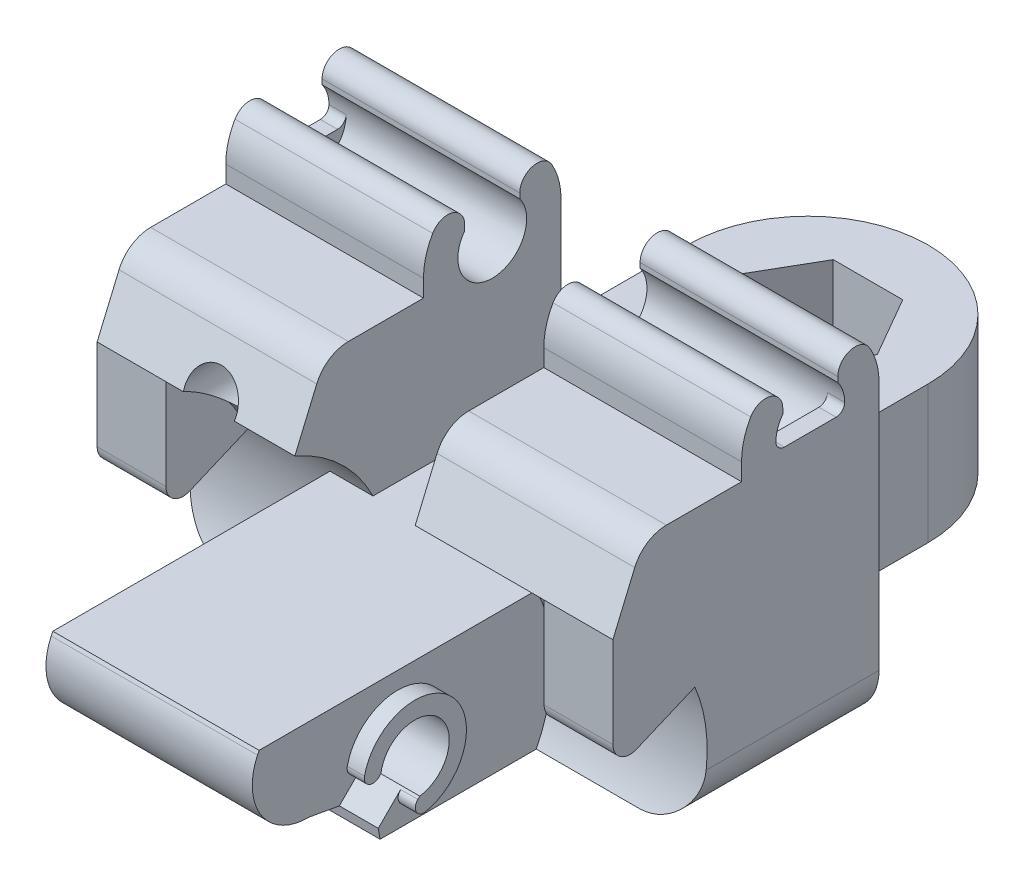
from build123d import *
from build123d.topology import SkipClean

# Parameters (mm, degrees)
BOSS_EXTRUDE1_DEPTH      = 6
BOSS_EXTRUDE2_DEPTH      = 7
SKETCH6_R                = 7
BOSS_EXTRUDE3_DEPTH      = 18
BOSS_EXTRUDE4_DEPTH      = 8
BOSS_EXTRUDE4_DEPTH_BACK = 8
SKETCH7_R                = 4.5
CUT_EXTRUDE2_DEPTH       = 5
CUT_EXTRUDE4_START       = -5
CUT_EXTRUDE4_DEPTH       = 5
BOSS_EXTRUDE6_DEPTH      = 1
FILLET3_R                = 0.5
FILLET3_OF_MIRROR1_R     = 0.5
BOSS_EXTRUDE5_DEPTH      = 15
SKETCH20_W               = 7
SKETCH20_H               = 38
CUT_EXTRUDE7_DEPTH       = 42.913087917
FILLET1_START            = -6
FILLET1_DEPTH            = 12
FILLET2_R                = 1
CUT_EXTRUDE8_DEPTH       = 42.560578801
BOSS_EXTRUDE7_DEPTH      = 1
FILLET4_R                = 0.5
FILLET4_OF_MIRROR2_R     = 0.5
FILLET5_R                = 3
FILLET7_R                = 2
CUT_SWEEP1_PROFILE_R     = 1.5
BOSS_EXTRUDE8_DEPTH      = 4
FILLET8_R                = 1
FILLET8_OF_MIRROR3_R     = 1


with BuildPart() as part:
    # Sketch3 → Boss-Extrude1 (new, symmetric)
    with BuildSketch(Plane(origin=(0, 0, 0), x_dir=(0, 0, -1), z_dir=(1, 0, 0))):
        with BuildLine():
            ThreePointArc((2, 0), (1.51090791, -1.310403483), (0.282842712, -1.979898987))
            Line((0.282842712, -1.979898987), (-1.13137085, -3.39411255))
            Line((-1.13137085, -3.39411255), (-0.81880413, -5.166766505))
            Line((-0.81880413, -5.166766505), (-3.807139593, -8.155101968))
            ThreePointArc((-3.807139593, -8.155101968), (4.834032667, -7.591582718), (9, 0))
            ThreePointArc((9, 0), (-1.949882341, 8.7862369), (-8.155101968, -3.807139593))
            Line((-8.155101968, -3.807139593), (-5.166766505, -0.81880413))
            Line((-5.166766505, -0.81880413), (-3.39411255, -1.13137085))
            Line((-3.39411255, -1.13137085), (-1.979898987, 0.282842712))
            ThreePointArc((-1.979898987, 0.282842712), (0.14177804, 1.994968418), (2, 0))
        make_face()
    extrude(amount=BOSS_EXTRUDE1_DEPTH, both=True)

    # Sketch5 → Boss-Extrude2 (add, symmetric)
    with BuildSketch(Plane(origin=(0, 0, 0), x_dir=(0, 0, -1), z_dir=(1, 0, 0))):
        with BuildLine():
            Line((0, 9), (29.855960009, 9))
            Line((29.855960009, 9), (29.855960009, -9))
            Line((29.855960009, -9), (0, -9))
            ThreePointArc((0, -9), (9, 0), (0, 9))
        make_face()
    extrude(amount=BOSS_EXTRUDE2_DEPTH, both=True)

    # Sketch6 → Boss-Extrude3 (add)
    with BuildSketch(Plane(origin=(0, 9, 0), x_dir=(1, 0, 0), z_dir=(0, 1, 0))):
        with Locations((0, 29.855960009)):
            Circle(SKETCH6_R)
    extrude(amount=-BOSS_EXTRUDE3_DEPTH)

    # Sketch7 → Boss-Extrude4 (add, two sides: drawn at the far end of the back side and taken through both)
    with BuildSketch(Plane(origin=(0, 0, 0), x_dir=(1, 0, 0), z_dir=(0, 1, 0)).offset(-BOSS_EXTRUDE4_DEPTH_BACK)):
        with Locations((0, 29.855960009)):
            Circle(SKETCH7_R)
    extrude(amount=BOSS_EXTRUDE4_DEPTH + BOSS_EXTRUDE4_DEPTH_BACK)

    # Sketch8 → Cut-Extrude2 (cut)
    with BuildSketch(Plane(origin=(0, 9, 0), x_dir=(1, 0, 0), z_dir=(0, 1, 0))):
        with BuildLine():
            Line((6, -9), (6, 0))
            Line((6, 0), (7, 0))
            Line((7, 0), (7, 29.855960009))
            ThreePointArc((7, 29.855960009), (0, 36.855960009), (-7, 29.855960009))
            Line((-7, 29.855960009), (-7, 0))
            Line((-7, 0), (-6, 0))
            Line((-6, 0), (-6, -9))
            Line((-6, -9), (6, -9))
        make_face()
    extrude(amount=-CUT_EXTRUDE2_DEPTH, mode=Mode.SUBTRACT)

    # Sketch9 → Cut-Extrude4 (cut)
    with BuildSketch(Plane.XZ.offset(9).offset(CUT_EXTRUDE4_START)):
        with BuildLine():
            Line((6, 0), (6, 9))
            Line((6, 9), (-6, 9))
            Line((-6, 9), (-6, 0))
            Line((-6, 0), (-7, 0))
            Line((-7, 0), (-7, -29.855960009))
            ThreePointArc((-7, -29.855960009), (0, -36.855960009), (7, -29.855960009))
            Line((7, -29.855960009), (7, 0))
            Line((7, 0), (6, 0))
        make_face()
    extrude(amount=CUT_EXTRUDE4_DEPTH, mode=Mode.SUBTRACT)

    # Sketch24 → Boss-Extrude6 (add)
    with SkipClean():  # the faces are left unmerged after this step: merging them gives an invalid solid
        with BuildSketch(Plane.ZY.offset(6)):
            with BuildLine():
                ThreePointArc((-0.282842712, -1.979898987), (-1.414213562, 1.414213562), (1.979898987, 0.282842712))
                Line((1.979898987, 0.282842712), (2.925806694, -0.663064995))
                ThreePointArc((2.925806694, -0.663064995), (2.981393976, -0.333601496), (3, 0))
                ThreePointArc((3, 0), (-2.344055778, 1.872272018), (0.663064995, -2.925806694))
                Line((0.663064995, -2.925806694), (-0.282842712, -1.979898987))
            make_face()
        boss_extrude6 = extrude(amount=BOSS_EXTRUDE6_DEPTH)

    # Fillet3
    # the kernel refuses this fillet: 0.5 mm, written as the material it takes off along each edge
    with BuildSketch(Plane(origin=(-6, -0.663064995, 2.925806694), x_dir=(0, 0.9999849386062066, 0.005488402385122609), z_dir=(-1, 0, 0))) as fillet3_piece_1:
        with BuildLine():
            CenterArc((1.186161173, 0.488233633), FILLET3_R, 135.314463872, 147.140119621)
            Line((0.830672664, 0.839841255), (0, 0))
            ThreePointArc((0, 0), (0.646997003, -0.070598205), (1.293994007, 0))
        make_face()
    extrude(amount=4.234985017, mode=Mode.SUBTRACT)
    with BuildSketch(Plane(origin=(-6, -2.925806694, 0.663064995), x_dir=(0, -0.005488402385198552, -0.9999849386062063), z_dir=(-1, 0, 0))) as fillet3_piece_2:
        with BuildLine():
            CenterArc((1.186161173, -0.488233633), FILLET3_R, 77.545416507, 147.140119621)
            Line((0.830672664, -0.839841255), (0, 0))
            ThreePointArc((0, 0), (0.646997003, 0.070598205), (1.293994007, 0))
        make_face()
    extrude(amount=4.234985017, mode=Mode.SUBTRACT)

    # Mirror1: Boss-Extrude6 across plane
    add(boss_extrude6.mirror(Plane(origin=(0, 0, 0), x_dir=(0, 0, 1), z_dir=(1, 0, 0))))

    # Fillet3 of Mirror1
    # the kernel refuses this fillet: 0.5 mm, written as the material it takes off along each edge
    with BuildSketch(Plane(origin=(6, -0.663064995, 2.925806694), x_dir=(0, 0.7071067811865444, -0.7071067811865507), z_dir=(1, 0, 0))) as fillet3_of_mirror1_piece_1:
        with BuildLine():
            CenterArc((1.181249511, 0.5), FILLET3_OF_MIRROR1_R, 122.859880379, 147.140119621)
            ThreePointArc((0.909956312, 0.92), (0.404784455, 0.509645734), (0, 0))
            Line((0, 0), (1.181249511, 0))
        make_face()
    extrude(amount=4.234985017, mode=Mode.SUBTRACT)
    with BuildSketch(Plane(origin=(6, -2.925806694, 0.663064995), x_dir=(0, 0.7071067811865442, -0.7071067811865509), z_dir=(1, 0, 0))) as fillet3_of_mirror1_piece_2:
        with BuildLine():
            CenterArc((1.181249511, -0.5), FILLET3_OF_MIRROR1_R, 90, 147.140119621)
            ThreePointArc((0.909956312, -0.92), (0.404784455, -0.509645734), (0, 0))
            Line((0, 0), (1.181249511, 0))
        make_face()
    extrude(amount=4.234985017, mode=Mode.SUBTRACT)

    # Sketch10 → Boss-Extrude5 (add, symmetric)
    with BuildSketch(Plane(origin=(0, 0, 0), x_dir=(0, 0, -1), z_dir=(1, 0, 0))):
        with BuildLine():
            ThreePointArc((8.062257748, -4), (9, 0), (8.062257748, 4))
            Line((8.062257748, 4), (19, 4))
            Line((19, 4), (19, -4))
            Line((19, -4), (8.062257748, -4))
        make_face()
        with BuildLine():
            Line((13.4, 17.166060556), (13.4, 14.7))
            ThreePointArc((13.4, 14.7), (15, 11.5), (16.6, 14.7))
            Line((16.6, 14.7), (16.6, 17.166060556))
            ThreePointArc((16.6, 17.166060556), (18.346640106, 15.69089023), (19, 13.5))
            Line((19, 13.5), (19, 4))
            Line((19, 4), (8.062257748, 4))
            ThreePointArc((8.062257748, 4), (6.173062485, 6.549297638), (3.516580156, 8.284543681))
            Line((3.516580156, 8.284543681), (5.305935203, 12.5))
            Line((5.305935203, 12.5), (11, 12.5))
            Line((11, 12.5), (11, 13.5))
            ThreePointArc((11, 13.5), (11.653359894, 15.69089023), (13.4, 17.166060556))
        make_face()
    extrude(amount=BOSS_EXTRUDE5_DEPTH, both=True)

    # Sketch20 → Cut-Extrude7 (cut, through all)
    with BuildSketch(Plane(origin=(0, 4, 0), x_dir=(1, 0, 0), z_dir=(0, 1, 0))):
        Rectangle(SKETCH20_W, SKETCH20_H)
    extrude(amount=CUT_EXTRUDE7_DEPTH, mode=Mode.SUBTRACT)

    # Fillet1: read off the stored shape, not the designer's step
    # Fillet1 outline → Fillet1 (cut)
    with BuildSketch(Plane.YZ.offset(FILLET1_START)):
        with BuildLine():
            ThreePointArc((-0.81880413, 5.166766505), (0.666331593, 7.940128227), (3.804881491, 8.156155764))
            ThreePointArc((3.804881491, 8.156155764), (-0.001245944, 8.999999913), (-3.807139593, 8.155101968))
            Line((-3.807139593, 8.155101968), (-0.81880413, 5.166766505))
        make_face()
    extrude(amount=FILLET1_DEPTH, mode=Mode.SUBTRACT)

    # Fillet2
    fillet2_edges = [part.edges().sort_by_distance(p)[0] for p in [
        (9.25, 17.166060556, -16.6),
        (9.25, 17.166060556, -13.4),
        (-9.25, 17.166060556, -13.4),
        (-9.25, 17.166060556, -16.6),
    ]]
    fillet(fillet2_edges, radius=FILLET2_R)

    # Sketch23 → Cut-Extrude8 (cut, through all)
    with BuildSketch(Plane(origin=(0, 4, 0), x_dir=(1, 0, 0), z_dir=(0, 1, 0))):
        Polygon((4.041451884, 29.855960009), (2.020725942, 33.355960009), (-2.020725942, 33.355960009), (-4.041451884, 29.855960009), (-2.020725942, 26.355960009), (2.020725942, 26.355960009), align=None)
    extrude(amount=-CUT_EXTRUDE8_DEPTH, mode=Mode.SUBTRACT)

    # Sketch25 → Boss-Extrude7 (add)
    with BuildSketch(Plane(origin=(15, 0, 0), x_dir=(0, 0, -1), z_dir=(1, 0, 0))):
        with BuildLine():
            Line((16.936491673, 13), (13.063508327, 13))
            ThreePointArc((13.063508327, 13), (15, 11.5), (16.936491673, 13))
        make_face()
    boss_extrude7 = extrude(amount=-BOSS_EXTRUDE7_DEPTH)

    # Fillet4
    fillet4_edges = [part.edges().sort_by_distance(p)[0] for p in [
        (14.5, 13, -13.063508327),
        (14.5, 13, -16.936491673),
    ]]
    fillet(fillet4_edges, radius=FILLET4_R)

    # Mirror2: Boss-Extrude7 across plane
    add(boss_extrude7.mirror(Plane(origin=(0, 0, 0), x_dir=(0, 0, 1), z_dir=(1, 0, 0))))

    # Fillet4 of Mirror2
    fillet4_of_mirror2_edges = [part.edges().sort_by_distance(p)[0] for p in [
        (-14.5, 13, -13.063508327),
        (-14.5, 13, -16.936491673),
    ]]
    fillet(fillet4_of_mirror2_edges, radius=FILLET4_OF_MIRROR2_R)

    # Fillet5
    fillet5_edges = [part.edges().sort_by_distance(p)[0] for p in [
        (15, -4, -13.531128874),
        (-15, -4, -13.531128874),
    ]]
    fillet(fillet5_edges, radius=FILLET5_R)

    # Fillet7
    fillet7_edges = [part.edges().sort_by_distance(p)[0] for p in [
        (9.25, 12.5, -5.305935203),
        (-9.25, 12.5, -5.305935203),
    ]]
    fillet(fillet7_edges, radius=FILLET7_R)

    # Cut-Sweep1: sweep along a path in Sketch27
    with BuildLine(Plane.ZY.offset(8.5)) as cut_sweep1_path:
        Line((0, 8.5), (-25.421416279, 8.5))
    # Cut-Sweep1 profile (on start of the path) → Cut-Sweep1 (sweep, cut)
    with BuildSketch(Plane(origin=(-8.5, 8.5, 0), x_dir=(0, -1, 0), z_dir=(0, 0, -1))):
        Circle(CUT_SWEEP1_PROFILE_R)
    sweep(path=cut_sweep1_path.line, mode=Mode.SUBTRACT)

    # Sketch28 → Boss-Extrude8 (add)
    with BuildSketch(Plane(origin=(15, 0, 0), x_dir=(0, 0, -1), z_dir=(1, 0, 0))):
        with BuildLine():
            Line((3.516580156, 1.492699716), (8.284543681, 3.516580156))
            ThreePointArc((8.284543681, 3.516580156), (6.363961031, 6.363961031), (3.516580156, 8.284543681))
            Line((3.516580156, 8.284543681), (3.516580156, 1.492699716))
        make_face()
    boss_extrude8 = extrude(amount=-BOSS_EXTRUDE8_DEPTH)

    # Fillet8
    fillet8_edges = [part.edges().sort_by_distance(p)[0] for p in [
        (13, 1.492699716, -3.516580156),
    ]]
    fillet(fillet8_edges, radius=FILLET8_R)

    # Mirror3: Boss-Extrude8 across plane
    add(boss_extrude8.mirror(Plane(origin=(0, 0, 0), x_dir=(0, 0, 1), z_dir=(1, 0, 0))))

    # Fillet8 of Mirror3
    fillet8_of_mirror3_edges = [part.edges().sort_by_distance(p)[0] for p in [
        (-13, 1.492699716, -3.516580156),
    ]]
    fillet(fillet8_of_mirror3_edges, radius=FILLET8_OF_MIRROR3_R)


solid = part.part
